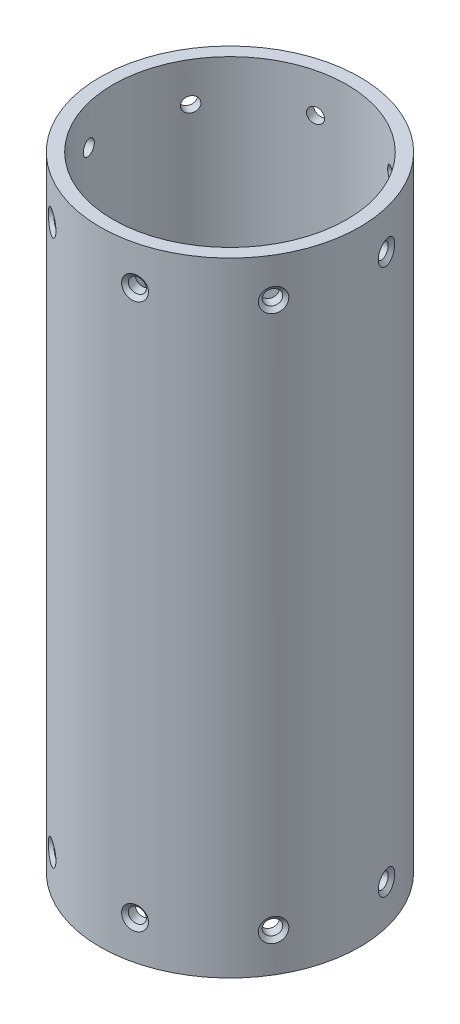
from build123d import *

# Parameters (mm, degrees)
SKETCH1_R           = 31.75
SKETCH1_R_2         = 28.575
BOSS_EXTRUDE1_DEPTH = 152.4
CIRPATTERN1_COUNT   = 8
LPATTERN1_COUNT     = 2
LPATTERN1_PITCH     = 133.35


# Read off the part's stored shape, not the designer's step: CSK for #4 Flat Head Machine Screw (100)2
with BuildPart() as part:
    # Sketch1 → Boss-Extrude1 (new body)
    with BuildSketch(Plane(origin=(0, 0, 0), x_dir=(1, 0, 0), z_dir=(0, 1, 0))):
        with Locations(Location((0, 0, 0), (0, 0, 90))):
            Circle(SKETCH1_R)
        with Locations(Location((0, 0, 0), (0, 0, 90))):
            Circle(SKETCH1_R_2, mode=Mode.SUBTRACT)
    extrude(amount=BOSS_EXTRUDE1_DEPTH)

    # CSK for _4 Flat Head Machine Screw _ 2 → CSK for #4 Flat Head Machine Screw (100)2 (revolve, cut)
    with BuildSketch(Plane(origin=(0, 142.875, 0), x_dir=(0.5184442447871813, 0, -0.8551114342862275), z_dir=(0, -1, 0))):
        Polygon((0, -31.750018641), (2.857522216, -31.750018641), (1.8288, -30.886818209), (1.8288, -28.516386801), (0, -28.516386801), align=None)
    csk_for_4_flat_head_machine_screw_100 = revolve(axis=Axis((0, 142.875, 0), (0.8551114342862275, 0, 0.5184442447871813)), mode=Mode.SUBTRACT)

    # CirPattern1: CSK for #4 Flat Head Machine Screw (100)2 ×8 about axis
    cirpattern1_axis = Axis((0, 152.4, 0), (0, -1, 0))
    for i in range(1, CIRPATTERN1_COUNT):
        add(csk_for_4_flat_head_machine_screw_100.rotate(cirpattern1_axis, i * 360 / CIRPATTERN1_COUNT), mode=Mode.SUBTRACT)

    # LPattern1: CSK for #4 Flat Head Machine Screw (100)2 ×2
    with Locations(*[(0, -i * LPATTERN1_PITCH, 0) for i in range(1, LPATTERN1_COUNT)]):
        add(csk_for_4_flat_head_machine_screw_100, mode=Mode.SUBTRACT)

    # LPattern1 copy 1 sketch → LPattern1 copy 1 (revolve, cut)
    with BuildSketch(Plane(origin=(0, 9.525, 0), x_dir=(0.9712505350101006, 0, -0.23805965269779206), z_dir=(0, -1, 0))):
        Polygon((0, -31.750018641), (2.857522216, -31.750018641), (1.8288, -30.886818209), (1.8288, -28.516386801), (0, -28.516386801), align=None)
    revolve(axis=Axis((0, 9.525, 0), (0.23805965269779206, 0, 0.9712505350101006)), mode=Mode.SUBTRACT)

    # LPattern1 copy 2 sketch → LPattern1 copy 2 (revolve, cut)
    with BuildSketch(Plane(origin=(0, 9.525, 0), x_dir=(0.8551114342862275, 0, 0.5184442447871813), z_dir=(0, -1, 0))):
        Polygon((0, -31.750018641), (2.857522216, -31.750018641), (1.8288, -30.886818209), (1.8288, -28.516386801), (0, -28.516386801), align=None)
    revolve(axis=Axis((0, 9.525, 0), (-0.5184442447871813, 0, 0.8551114342862275)), mode=Mode.SUBTRACT)

    # LPattern1 copy 3 sketch → LPattern1 copy 3 (revolve, cut)
    with BuildSketch(Plane(origin=(0, 9.525, 0), x_dir=(0.23805965269779206, 0, 0.9712505350101006), z_dir=(0, -1, 0))):
        Polygon((0, -31.750018641), (2.857522216, -31.750018641), (1.8288, -30.886818209), (1.8288, -28.516386801), (0, -28.516386801), align=None)
    revolve(axis=Axis((0, 9.525, 0), (-0.9712505350101006, 0, 0.23805965269779206)), mode=Mode.SUBTRACT)

    # LPattern1 copy 4 sketch → LPattern1 copy 4 (revolve, cut)
    with BuildSketch(Plane(origin=(0, 9.525, 0), x_dir=(-0.5184442447871812, 0, 0.8551114342862276), z_dir=(0, -1, 0))):
        Polygon((0, -31.750018641), (2.857522216, -31.750018641), (1.8288, -30.886818209), (1.8288, -28.516386801), (0, -28.516386801), align=None)
    revolve(axis=Axis((0, 9.525, 0), (-0.8551114342862276, 0, -0.5184442447871812)), mode=Mode.SUBTRACT)

    # LPattern1 copy 5 sketch → LPattern1 copy 5 (revolve, cut)
    with BuildSketch(Plane(origin=(0, 9.525, 0), x_dir=(-0.9712505350101006, 0, 0.23805965269779217), z_dir=(0, -1, 0))):
        Polygon((0, -31.750018641), (2.857522216, -31.750018641), (1.8288, -30.886818209), (1.8288, -28.516386801), (0, -28.516386801), align=None)
    revolve(axis=Axis((0, 9.525, 0), (-0.23805965269779217, 0, -0.9712505350101006)), mode=Mode.SUBTRACT)

    # LPattern1 copy 6 sketch → LPattern1 copy 6 (revolve, cut)
    with BuildSketch(Plane(origin=(0, 9.525, 0), x_dir=(-0.8551114342862276, 0, -0.5184442447871812), z_dir=(0, -1, 0))):
        Polygon((0, -31.750018641), (2.857522216, -31.750018641), (1.8288, -30.886818209), (1.8288, -28.516386801), (0, -28.516386801), align=None)
    revolve(axis=Axis((0, 9.525, 0), (0.5184442447871812, 0, -0.8551114342862276)), mode=Mode.SUBTRACT)

    # LPattern1 copy 7 sketch → LPattern1 copy 7 (revolve, cut)
    with BuildSketch(Plane(origin=(0, 9.525, 0), x_dir=(-0.23805965269779222, 0, -0.9712505350101005), z_dir=(0, -1, 0))):
        Polygon((0, -31.750018641), (2.857522216, -31.750018641), (1.8288, -30.886818209), (1.8288, -28.516386801), (0, -28.516386801), align=None)
    revolve(axis=Axis((0, 9.525, 0), (0.9712505350101005, 0, -0.23805965269779222)), mode=Mode.SUBTRACT)


solid = part.part
